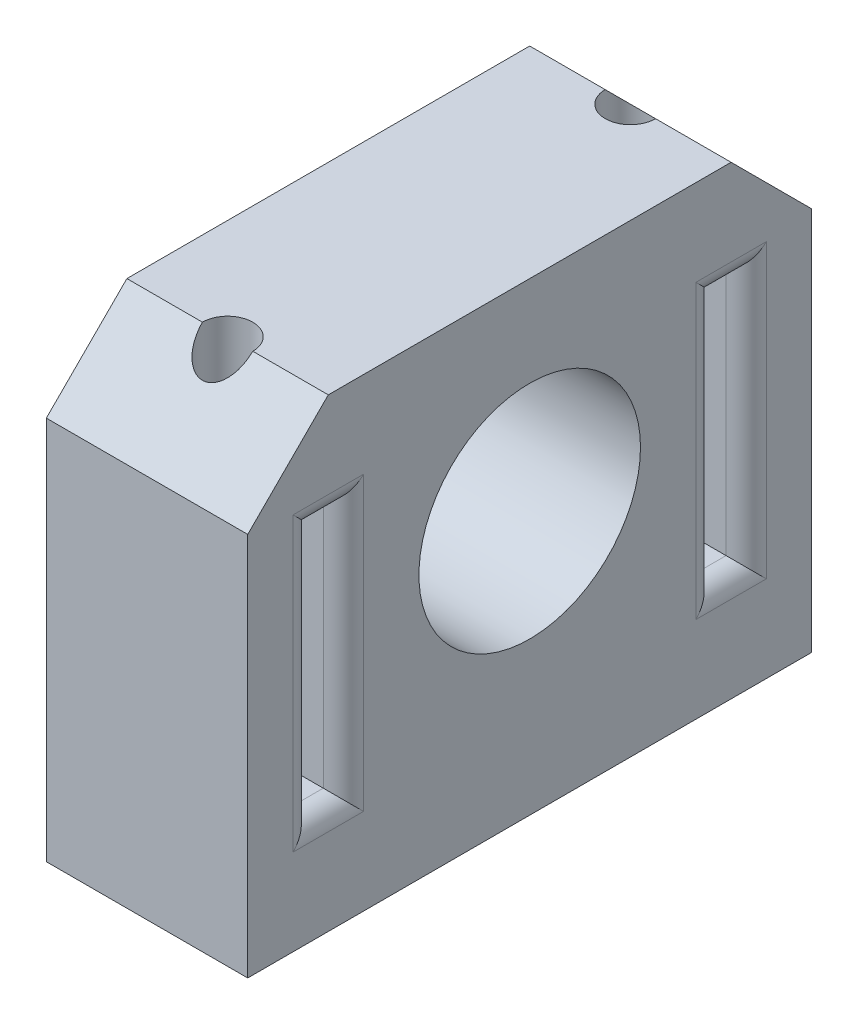
from build123d import *

# Parameters (mm, degrees)
SKETCH_2_W          = 56
SKETCH_2_H          = 46.15
SKETCH_2_R          = 11
EXTRUDE_1_DEPTH     = 20
SKETCH_3_R          = 2.5
CUT_EXTRUDE_1_DEPTH = 58.565810165
SKETCH_4_W          = 3
SKETCH_4_H          = 25
CUT_EXTRUDE_2_DEPTH = 44.218312091
CHAMFER_1_SIZE      = 8
FILLET_1_R          = 1
FILLET_2_R          = 2


with BuildPart() as part:
    # 스케치2 → 보스-돌출1 (new body)
    with BuildSketch(Plane(origin=(0, 0, 0), x_dir=(0, 0, -1), z_dir=(1, 0, 0))):
        with Locations((0, -3.075)):
            Rectangle(SKETCH_2_W, SKETCH_2_H)
        Circle(SKETCH_2_R, mode=Mode.SUBTRACT)
    extrude(amount=EXTRUDE_1_DEPTH)

    # 스케치3 → 컷-돌출1 (cut, through all)
    with BuildSketch(Plane(origin=(0, 20, 0), x_dir=(1, 0, 0), z_dir=(0, 1, 0))):
        with Locations(Location((10, 20, 0), (0, 0, 270))):
            Circle(SKETCH_3_R)
        with Locations(Location((10, -20, 0), (0, 0, 90))):
            Circle(SKETCH_3_R)
    extrude(amount=-CUT_EXTRUDE_1_DEPTH, mode=Mode.SUBTRACT)

    # 스케치4 → 컷-돌출2 (cut, through all)
    with BuildSketch(Plane(origin=(20, 0, 0), x_dir=(0, 0, -1), z_dir=(1, 0, 0))):
        with Locations((-20, -3.075)):
            Rectangle(SKETCH_4_W, SKETCH_4_H)
        with Locations((20, -3.075)):
            Rectangle(SKETCH_4_W, SKETCH_4_H)
    extrude(amount=-CUT_EXTRUDE_2_DEPTH, mode=Mode.SUBTRACT)

    # 모따기1
    # the kernel refuses this chamfer: 8 mm, written as the material it takes off along each edge
    with BuildSketch(Plane(origin=(-20.573463904, 20, 28), x_dir=(0, -0.9996219169112968, 0.027495876610586494), z_dir=(1, 0, 0))) as chamfer_1_piece_1:
        Polygon((CHAMFER_1_SIZE * 0.999621916911, CHAMFER_1_SIZE * 0.0274958766106), (-CHAMFER_1_SIZE * 0.0274958766106, CHAMFER_1_SIZE * 0.999621916911), (0, 0), align=None)
    extrude(amount=61.146927807, mode=Mode.SUBTRACT)
    with BuildSketch(Plane(origin=(-20.573463904, 20, -28), x_dir=(0, -0.9996219169112968, -0.027495876610586494), z_dir=(1, 0, 0))) as chamfer_1_piece_2:
        Polygon((CHAMFER_1_SIZE * 0.999621916911, -CHAMFER_1_SIZE * 0.0274958766106), (-CHAMFER_1_SIZE * 0.0274958766106, -CHAMFER_1_SIZE * 0.999621916911), (0, 0), align=None)
    extrude(amount=61.146927807, mode=Mode.SUBTRACT)

    # 필렛1
    fillet_1_edges = [part.edges().sort_by_distance(p)[0] for p in [
        (12.5, 9.425, -20),
        (12, -3.075, -18.5),
        (12.5, -15.575, -20),
        (12, -3.075, -21.5),
        (7.5, 9.425, -20),
        (8, -3.075, -18.5),
        (7.5, -15.575, -20),
        (8, -3.075, -21.5),
        (12.5, -15.575, 20),
        (12, -3.075, 18.5),
        (12.5, 9.425, 20),
        (12, -3.075, 21.5),
        (7.5, -15.575, 20),
        (8, -3.075, 18.5),
        (7.5, 9.425, 20),
        (8, -3.075, 21.5),
    ]]
    fillet(fillet_1_edges, radius=FILLET_1_R)

    # 필렛2
    fillet_2_edges = [part.edges().sort_by_distance(p)[0] for p in [
        (0, -3.075, 21.5),
        (0, 9.425, 20),
        (0, -3.075, 18.5),
        (0, -15.575, 20),
        (20, -3.075, 21.5),
        (20, -15.575, 20),
        (20, -3.075, 18.5),
        (20, 9.425, 20),
        (0, -3.075, -21.5),
        (0, -15.575, -20),
        (0, -3.075, -18.5),
        (0, 9.425, -20),
        (20, -3.075, -21.5),
        (20, 9.425, -20),
        (20, -3.075, -18.5),
        (20, -15.575, -20),
    ]]
    fillet(fillet_2_edges, radius=FILLET_2_R)


solid = part.part
